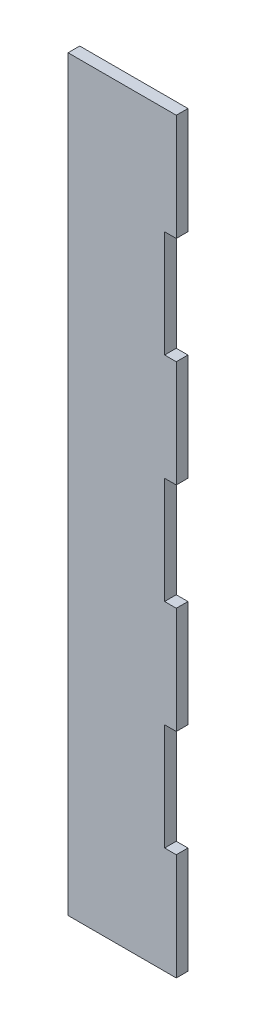
from build123d import *

# Parameters (mm, degrees)
BOSS_EXTRUDE1_DEPTH = 3.175
SKETCH2_W           = 3.175
SKETCH2_H           = 203.2
BOSS_EXTRUDE2_DEPTH = 13.56


with BuildPart() as part:
    # Sketch1 → Boss-Extrude1 (new body)
    with BuildSketch(Plane.XY):
        Polygon((-6.35, 101.6), (-6.35, -101.6), (9.525, -101.6), (9.525, -72.571428571), (6.35, -72.571428571), (6.35, -43.542857143), (9.525, -43.542857143), (9.525, -14.514285714), (6.35, -14.514285714), (6.35, 14.514285714), (9.525, 14.514285714), (9.525, 43.542857143), (6.35, 43.542857143), (6.35, 72.571428571), (9.525, 72.571428571), (9.525, 101.6), align=None)
    extrude(amount=BOSS_EXTRUDE1_DEPTH)

    # Sketch2 → Boss-Extrude2 (add)
    with BuildSketch(Plane.ZY.offset(6.35)):
        with Locations((1.5875, 0)):
            Rectangle(SKETCH2_W, SKETCH2_H)
    extrude(amount=BOSS_EXTRUDE2_DEPTH)


solid = part.part
